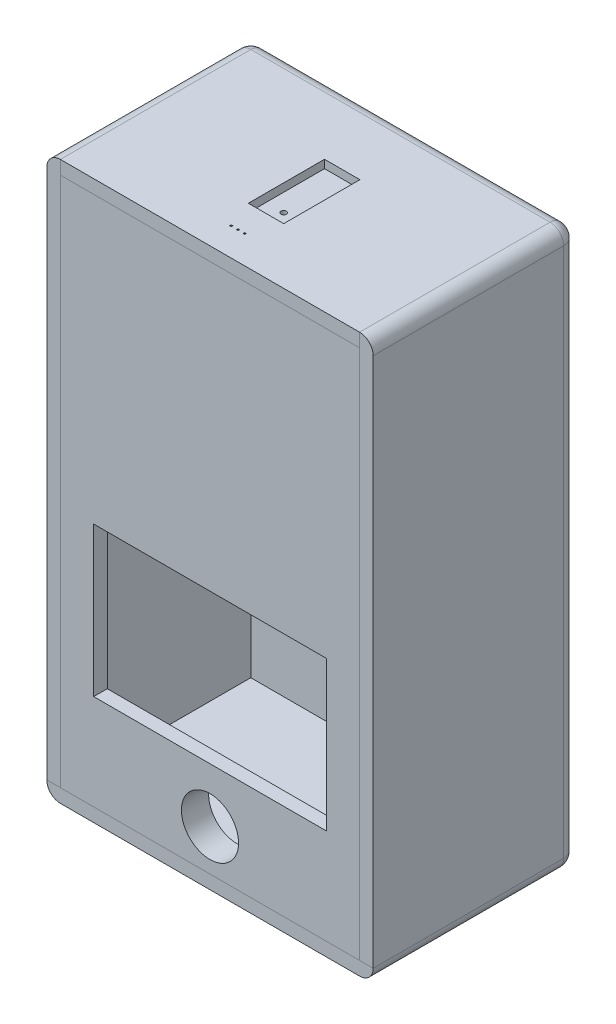
from build123d import *

# Parameters (mm, degrees)
SKETCH5_W             = 120
SKETCH5_H             = 75
BOSS_EXTRUDE4_DEPTH   = 5
FILLET1_R             = 5
SKETCH7_W             = 5
SKETCH7_H             = 75
BOSS_EXTRUDE7_DEPTH   = 200
BOSS_EXTRUDE7_2_DEPTH = 200
FILLET3_R             = 5
SKETCH8_W             = 110
SKETCH8_H             = 5
BOSS_EXTRUDE8_DEPTH   = 200
FILLET5_R             = 5
BOSS_EXTRUDE9_REACH   = 251.098
SKETCH13_W            = 110
SKETCH13_H            = 5
FILLET7_R             = 5
FILLET8_R             = 5
FILLET9_R             = 5
FILLET10_R            = 5
SKETCH14_W            = 110
SKETCH14_H            = 195
BOSS_EXTRUDE10_DEPTH  = 5
SKETCH15_R            = 10.5
CUT_EXTRUDE8_DEPTH    = 5
SKETCH16_R            = 13.5
SKETCH16_R_2          = 10.5
BOSS_EXTRUDE11_DEPTH  = 5
SKETCH17_R            = 5
SKETCH17_R_2          = 5.77596
CUT_EXTRUDE9_DEPTH    = 5
CUT_EXTRUDE10_DEPTH   = 5
CUT_EXTRUDE11_DEPTH   = 3
SKETCH20_R            = 1
CUT_EXTRUDE12_DEPTH   = 2


with BuildPart() as part:
    # Sketch5 → Boss-Extrude4 (new body)
    with BuildSketch(Plane(origin=(0, 0, 0), x_dir=(1, 0, 0), z_dir=(0, 1, 0))):
        with Locations((-60, 37.5)):
            Rectangle(SKETCH5_W, SKETCH5_H)
    extrude(amount=BOSS_EXTRUDE4_DEPTH)

    # Fillet1
    fillet1_edges = [part.edges().sort_by_distance(p)[0] for p in [
        (0, 0, -37.5),
        (-120, 0, -37.5),
    ]]
    fillet(fillet1_edges, radius=FILLET1_R - 0.0001)  # a hair under: the kernel refuses the full size

    # Fillet10
    fillet10_edges = [part.edges().sort_by_distance(p)[0] for p in [
        (-60, 0, -75),
        (-118.535563195, 1.464436805, -75),
        (-1.464436805, 1.464436805, -75),
    ]]
    fillet(fillet10_edges, radius=FILLET10_R - 0.0001)  # a hair under: the kernel refuses the full size

    # Sketch17 → Cut-Extrude9 (cut)
    with BuildSketch(Plane.XZ):
        with Locations(Location((-70, -60, 0), (0, 0, 270))):
            Circle(SKETCH17_R)
        with Locations(Location((-50, -60, 0), (0, 0, 90))):
            Circle(SKETCH17_R)
        with Locations(Location((-25, -60, 0), (0, 0, 270))):
            Circle(SKETCH17_R_2)
    extrude(amount=-CUT_EXTRUDE9_DEPTH, mode=Mode.SUBTRACT)


with BuildPart() as body_2:
    # Sketch7 → Boss-Extrude7 (new body)
    with BuildSketch(Plane(origin=(0, 5, 0), x_dir=(1, 0, 0), z_dir=(0, 1, 0))):
        with Locations((-117.5, 37.5)):
            Rectangle(SKETCH7_W, SKETCH7_H)
    extrude(amount=BOSS_EXTRUDE7_DEPTH)

    # Fillet3
    fillet3_edges = [body_2.edges().sort_by_distance(p)[0] for p in [
        (-120, 205, -37.5),
    ]]
    fillet(fillet3_edges, radius=FILLET3_R - 0.0001)  # a hair under: the kernel refuses the full size

    # Fillet7
    fillet7_edges = [body_2.edges().sort_by_distance(p)[0] for p in [
        (-118.535563195, 203.535563195, -75),
        (-120, 102.50005, -75),
    ]]
    fillet(fillet7_edges, radius=FILLET7_R - 0.0001)  # a hair under: the kernel refuses the full size


with BuildPart() as body_3:
    # Sketch7 → Boss-Extrude7 2 (new body)
    with BuildSketch(Plane(origin=(0, 5, 0), x_dir=(1, 0, 0), z_dir=(0, 1, 0))):
        with Locations((-2.5, 37.5)):
            Rectangle(SKETCH7_W, SKETCH7_H)
    extrude(amount=BOSS_EXTRUDE7_2_DEPTH)

    # Fillet5
    fillet5_edges = [body_3.edges().sort_by_distance(p)[0] for p in [
        (0, 205, -37.5),
    ]]
    fillet(fillet5_edges, radius=FILLET5_R - 0.0001)  # a hair under: the kernel refuses the full size

    # Fillet8
    fillet8_edges = [body_3.edges().sort_by_distance(p)[0] for p in [
        (-1.464436805, 203.535563195, -75),
        (0, 102.50005, -75),
    ]]
    fillet(fillet8_edges, radius=FILLET8_R - 0.0001)  # a hair under: the kernel refuses the full size


with BuildPart() as body_4:
    # Sketch8 → Boss-Extrude8 (new body)
    with BuildSketch(Plane(origin=(0, 5, 0), x_dir=(1, 0, 0), z_dir=(0, 1, 0))):
        with Locations((-60, 72.5)):
            Rectangle(SKETCH8_W, SKETCH8_H)
    extrude(amount=BOSS_EXTRUDE8_DEPTH)


with BuildPart() as body_5:

    # Sketch13 → Boss-Extrude9 (new, up to next)
    with BuildSketch(Plane.XY, mode=Mode.PRIVATE) as boss_extrude9_sk1:
        with Locations((-60, 202.5)):
            Rectangle(SKETCH13_W, SKETCH13_H)
    boss_extrude9_tool1 = extrude(boss_extrude9_sk1.sketch, amount=-BOSS_EXTRUDE9_REACH, mode=Mode.PRIVATE) - body_4.part
    add(boss_extrude9_tool1.solids().sort_by_distance((-60, 202.5, 0))[0])

    # Sketch18 → Cut-Extrude10 (cut)
    with BuildSketch(Plane(origin=(0, 205, 0), x_dir=(1, 0, 0), z_dir=(0, 1, 0))):
        Polygon((-62.5, 10), (-62.8, 10), (-62.8, 10.6), (-62.2, 10.6), (-62.2, 10), align=None)
        Polygon((-59.7, 10.6), (-59.7, 10), (-60, 10), (-60.3, 10), (-60.3, 10.6), align=None)
        Polygon((-57.5, 10), (-57.8, 10), (-57.8, 10.6), (-57.2, 10.6), (-57.2, 10), align=None)
    extrude(amount=-CUT_EXTRUDE10_DEPTH, mode=Mode.SUBTRACT)

    # Sketch19 → Cut-Extrude11 (cut)
    with BuildSketch(Plane(origin=(0, 205, 0), x_dir=(1, 0, 0), z_dir=(0, 1, 0))):
        Polygon((-60, 20.6), (-66.5, 20.6), (-66.5, 48.6), (-60, 48.6), (-53.5, 48.6), (-53.5, 20.6), align=None)
    extrude(amount=-CUT_EXTRUDE11_DEPTH, mode=Mode.SUBTRACT)

    # Sketch20 → Cut-Extrude12 (cut)
    with BuildSketch(Plane(origin=(0, 202, 0), x_dir=(1, 0, 0), z_dir=(0, 1, 0))):
        with Locations(Location((-60, 27.1, 0), (0, 0, 270))):
            Circle(SKETCH20_R)
    extrude(amount=-CUT_EXTRUDE12_DEPTH, mode=Mode.SUBTRACT)


with BuildPart() as body_4_1:
    add(body_4.part)

    # Fillet9
    fillet9_edges = [body_4_1.edges().sort_by_distance(p)[0] for p in [
        (-60, 205, -75),
    ]]
    fillet(fillet9_edges, radius=FILLET9_R - 0.0001)  # a hair under: the kernel refuses the full size


with BuildPart() as body_6:
    # Sketch14 → Boss-Extrude10 (new body)
    with BuildSketch(Plane.XY):
        with Locations((-60, 102.5)):
            Rectangle(SKETCH14_W, SKETCH14_H)
    extrude(amount=-BOSS_EXTRUDE10_DEPTH)

    # Sketch15 → Cut-Extrude8 (cut)
    with BuildSketch(Plane.XY):
        with Locations((-60, 20.12)):
            Circle(SKETCH15_R)
        Polygon((-17.25, 95.06), (-17.25, 40.12), (-60, 40.12), (-102.75, 40.12), (-102.75, 95.06), align=None)
    extrude(amount=-CUT_EXTRUDE8_DEPTH, mode=Mode.SUBTRACT)

    # Sketch16 → Boss-Extrude11 (add)
    with BuildSketch(Plane(origin=(0, 0, -5), x_dir=(-1, 0, 0), z_dir=(0, 0, -1))):
        with Locations(Location((60, 20.12, 0), (0, 0, 180))):
            Circle(SKETCH16_R)
        with Locations(Location((60, 20.12, 0), (0, 0, 180))):
            Circle(SKETCH16_R_2, mode=Mode.SUBTRACT)
    extrude(amount=BOSS_EXTRUDE11_DEPTH)


solid = Compound([part.part, body_2.part, body_3.part, body_5.part, body_4_1.part, body_6.part])
